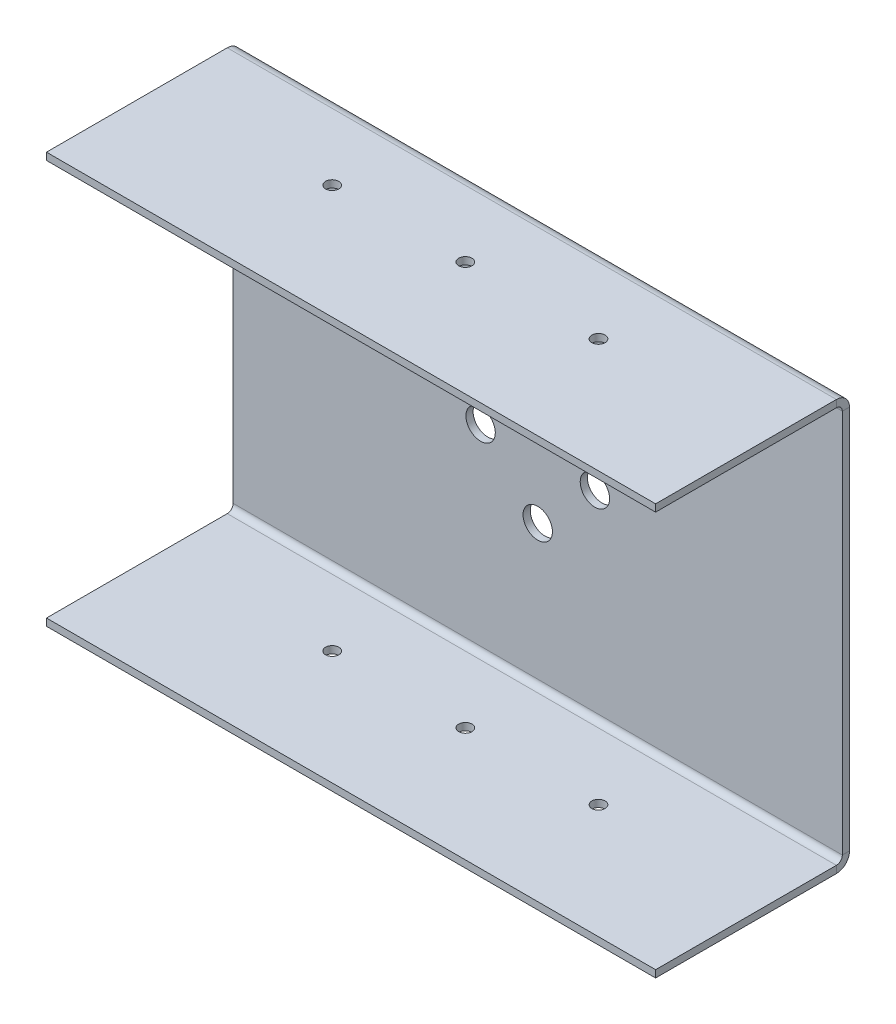
from build123d import *

# Parameters (mm, degrees)
SKETCH1_W                  = 135.38
SKETCH1_H                  = 172.035
SKETCH1_R                  = 3.2639
SKETCH1_R_2                = 1.4732
BASE_FLANGE1_DEPTH         = 1.6002
SKETCHED_BEND1_OUTLINE_W   = 135.38
SKETCHED_BEND1_OUTLINE_H   = 1.6002
SKETCHED_BEND1_DEPTH       = 129.239310973
SKETCHED_START             = 148.1082001
SKETCHED_BEND1_2_OUTLINE_W = 135.38
SKETCHED_BEND1_2_OUTLINE_H = 1.6002
SKETCHED_BEND1_2_DEPTH     = 23.9267999
SKETCHED_START_2           = 131.860207433
SKETCHED_BEND1_3_OUTLINE_W = 135.38
SKETCHED_BEND1_3_OUTLINE_H = 1.6002
SKETCHED_BEND1_3_DEPTH     = 13.301592467
SKETCHED_START_3           = 130.391703893
SKETCHED_BEND1_4_OUTLINE_W = 135.38
SKETCHED_BEND1_4_OUTLINE_H = 88.066185133
SKETCHED_BEND1_4_OUTLINE_R = 3.2639
SKETCHED_BEND1_4_DEPTH     = 0.14770354
SKETCHED_START_4           = 128.939207433
SKETCHED_BEND1_5_OUTLINE_W = 135.38
SKETCHED_BEND1_5_OUTLINE_H = 88.066185133
SKETCHED_BEND1_5_OUTLINE_R = 3.2639
SKETCHED_BEND1_5_DEPTH     = 2.921
SKETCHED_START_5           = 129.239310973
SKETCHED_BEND1_6_OUTLINE_W = 135.38
SKETCHED_BEND1_6_OUTLINE_H = 1.6002
SKETCHED_BEND1_6_DEPTH     = 18.868889127
SKETCHED_BEND1_7_DEPTH     = 135.38
SKETCHED_START_6           = 87
SKETCHED_BEND1_8_OUTLINE_R = 1.4732
SKETCHED_BEND1_8_DEPTH     = 4


with BuildPart() as part:
    # Base-Flange1: sheet metal written as solids
    # Sketch1 → Base-Flange1 (new body)
    with BuildSketch(Plane(origin=(0, 0, 0), x_dir=(1, 0, 0), z_dir=(0, 1, 0))):
        with Locations((67.69, -86.0175)):
            Rectangle(SKETCH1_W, SKETCH1_H)
        with Locations(Location((67.69, -73.3175, 0), (0, 0, 270))):
            Circle(SKETCH1_R, mode=Mode.SUBTRACT)
        with Locations(Location((67.69, -98.7175, 0), (0, 0, 270))):
            Circle(SKETCH1_R, mode=Mode.SUBTRACT)
        with Locations(Location((54.99, -86.0175, 0), (0, 0, 270))):
            Circle(SKETCH1_R, mode=Mode.SUBTRACT)
        with Locations(Location((80.39, -86.0175, 0), (0, 0, 270))):
            Circle(SKETCH1_R, mode=Mode.SUBTRACT)
        with Locations(Location((38.1, -25.4, 0), (0, 0, 270))):
            Circle(SKETCH1_R_2, mode=Mode.SUBTRACT)
        with Locations(Location((97.28, -25.4, 0), (0, 0, 270))):
            Circle(SKETCH1_R_2, mode=Mode.SUBTRACT)
        with Locations(Location((97.28, -146.635, 0), (0, 0, 90))):
            Circle(SKETCH1_R_2, mode=Mode.SUBTRACT)
        with Locations(Location((38.1, -146.635, 0), (0, 0, 90))):
            Circle(SKETCH1_R_2, mode=Mode.SUBTRACT)
        with Locations(Location((67.69, -25.4, 0), (0, 0, 270))):
            Circle(SKETCH1_R_2, mode=Mode.SUBTRACT)
        with Locations(Location((67.69, -146.635, 0), (0, 0, 270))):
            Circle(SKETCH1_R_2, mode=Mode.SUBTRACT)
    extrude(amount=-BASE_FLANGE1_DEPTH)

    # Sketched Bend1: read off the stored shape, not the designer's step
    # Sketched Bend1 outline → Sketched Bend1 (cut)
    with BuildSketch(Plane.XY):
        with Locations((67.69, -0.8001)):
            Rectangle(SKETCHED_BEND1_OUTLINE_W, SKETCHED_BEND1_OUTLINE_H)
    extrude(amount=SKETCHED_BEND1_DEPTH, mode=Mode.SUBTRACT)

    # Sketched Bend1 4 outline → Sketched Bend1 4 (add)
    with BuildSketch(Plane.XY.offset(SKETCHED_START_3)):
        with Locations((67.69, 44.033092567)):
            Rectangle(SKETCHED_BEND1_4_OUTLINE_W, SKETCHED_BEND1_4_OUTLINE_H)
        with Locations((67.69, 31.333092567)):
            Circle(SKETCHED_BEND1_4_OUTLINE_R, mode=Mode.SUBTRACT)
        with Locations((54.99, 44.033092567)):
            Circle(SKETCHED_BEND1_4_OUTLINE_R, mode=Mode.SUBTRACT)
        with Locations((80.39, 44.033092567)):
            Circle(SKETCHED_BEND1_4_OUTLINE_R, mode=Mode.SUBTRACT)
        with Locations((67.69, 56.733092567)):
            Circle(SKETCHED_BEND1_4_OUTLINE_R, mode=Mode.SUBTRACT)
    extrude(amount=SKETCHED_BEND1_4_DEPTH)



with BuildPart() as body_2:
    # Sketched Bend1 2 outline → Sketched Bend1 2 (new body)
    with BuildSketch(Plane.XY.offset(SKETCHED_START)):
        with Locations((67.69, 88.866285133)):
            Rectangle(SKETCHED_BEND1_2_OUTLINE_W, SKETCHED_BEND1_2_OUTLINE_H)
    extrude(amount=SKETCHED_BEND1_2_DEPTH)


with BuildPart() as body_3:
    # Sketched Bend1 3 outline → Sketched Bend1 3 (new body)
    with BuildSketch(Plane.XY.offset(SKETCHED_START_2)):
        with Locations((67.69, 88.866285133)):
            Rectangle(SKETCHED_BEND1_3_OUTLINE_W, SKETCHED_BEND1_3_OUTLINE_H)
    extrude(amount=SKETCHED_BEND1_3_DEPTH)


with BuildPart() as part_1:
    add(part.part)

    add(body_3.part)  # Sketched Bend1 5 merges body 3
    # Sketched Bend1 5 outline → Sketched Bend1 5 (add)
    with BuildSketch(Plane.XY.offset(SKETCHED_START_4)):
        with Locations((67.69, 44.033092567)):
            Rectangle(SKETCHED_BEND1_5_OUTLINE_W, SKETCHED_BEND1_5_OUTLINE_H)
        with Locations((67.69, 31.333092567)):
            Circle(SKETCHED_BEND1_5_OUTLINE_R, mode=Mode.SUBTRACT)
        with Locations((54.99, 44.033092567)):
            Circle(SKETCHED_BEND1_5_OUTLINE_R, mode=Mode.SUBTRACT)
        with Locations((80.39, 44.033092567)):
            Circle(SKETCHED_BEND1_5_OUTLINE_R, mode=Mode.SUBTRACT)
        with Locations((67.69, 56.733092567)):
            Circle(SKETCHED_BEND1_5_OUTLINE_R, mode=Mode.SUBTRACT)
    extrude(amount=SKETCHED_BEND1_5_DEPTH)


    add(body_2.part)  # Sketched Bend1 6 merges body 2
    # Sketched Bend1 6 outline → Sketched Bend1 6 (add)
    with BuildSketch(Plane.XY.offset(SKETCHED_START_5)):
        with Locations((67.69, 88.866285133)):
            Rectangle(SKETCHED_BEND1_6_OUTLINE_W, SKETCHED_BEND1_6_OUTLINE_H)
    extrude(amount=SKETCHED_BEND1_6_DEPTH)

    # Sketched Bend1 7 outline → Sketched Bend1 7 (cut)
    with BuildSketch(Plane.YZ):
        with BuildLine():
            Line((1.3208, 130.539407433), (86.745385133, 130.539407433))
            ThreePointArc((86.745385133, 130.539407433), (87.67933177, 130.926260797), (88.066185133, 131.860207433))
            Line((88.066185133, 131.860207433), (0, 131.860207433))
            ThreePointArc((0, 131.860207433), (0.386853363, 130.926260797), (1.3208, 130.539407433))
        make_face()
        with BuildLine():
            Line((0, 128.939207433), (1.3208, 128.939207433))
            ThreePointArc((1.3208, 128.939207433), (-0.744658907, 129.794748526), (-1.6002, 131.860207433))
            Line((-1.6002, 131.860207433), (-1.6002, 129.239310973))
            Line((-1.6002, 129.239310973), (0, 129.239310973))
            Line((0, 129.239310973), (0, 128.939207433))
        make_face()
        with BuildLine():
            ThreePointArc((89.666385133, 131.860207433), (88.810844041, 129.794748526), (86.745385133, 128.939207433))
            Line((86.745385133, 128.939207433), (88.066185133, 128.939207433))
            Line((88.066185133, 128.939207433), (88.066185133, 129.239310973))
            Line((88.066185133, 129.239310973), (89.666385133, 129.239310973))
            Line((89.666385133, 129.239310973), (89.666385133, 131.860207433))
        make_face()
    extrude(amount=SKETCHED_BEND1_7_DEPTH, mode=Mode.SUBTRACT)

    # Sketched Bend1 8 outline → Sketched Bend1 8 (cut)
    with BuildSketch(Plane(origin=(0, 0, 0), x_dir=(1, 0, 0), z_dir=(0, 1, 0)).offset(SKETCHED_START_6)):
        with Locations((67.69, -146.635)):
            Circle(SKETCHED_BEND1_8_OUTLINE_R)
        with Locations((97.28, -146.635)):
            Circle(SKETCHED_BEND1_8_OUTLINE_R)
        with Locations((38.1, -146.635)):
            Circle(SKETCHED_BEND1_8_OUTLINE_R)
    extrude(amount=SKETCHED_BEND1_8_DEPTH, mode=Mode.SUBTRACT)


solid = part_1.part
